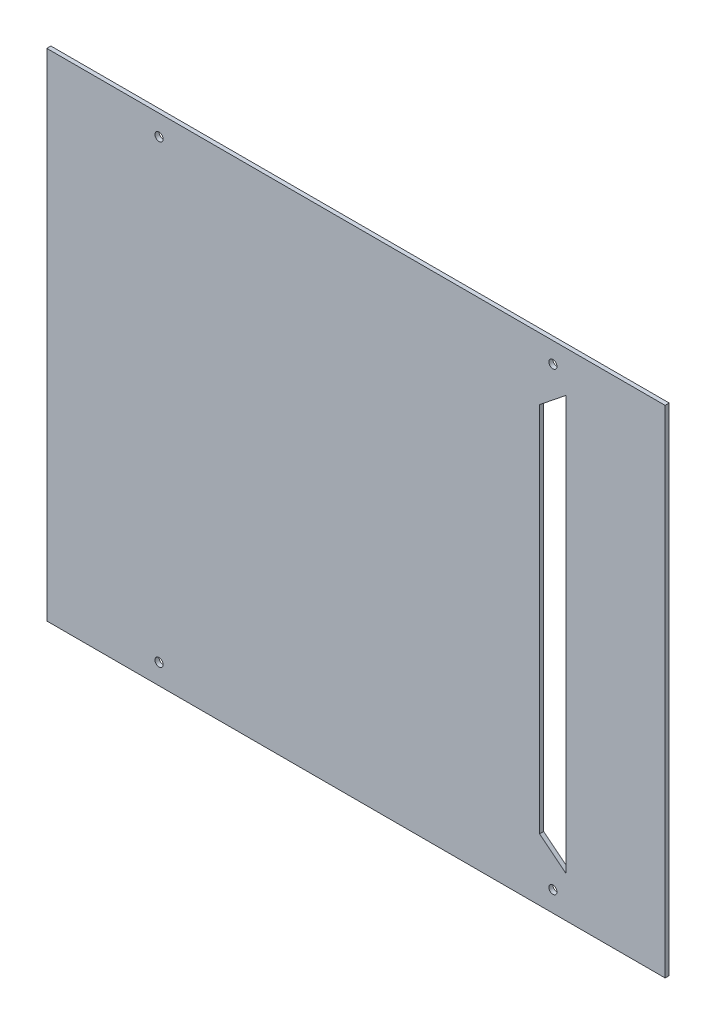
from build123d import *

# Parameters (mm, degrees)
SKETCH1_W           = 303
SKETCH1_H           = 243
SKETCH1_R           = 2
BOSS_EXTRUDE1_DEPTH = 2


with BuildPart() as part:
    # Sketch1 → Boss-Extrude1 (new body)
    with BuildSketch(Plane.XY):
        Rectangle(SKETCH1_W, SKETCH1_H)
        with Locations((-96.5, 111.5)):
            Circle(SKETCH1_R, mode=Mode.SUBTRACT)
        with Locations((96.5, 111.5)):
            Circle(SKETCH1_R, mode=Mode.SUBTRACT)
        with Locations((96.5, -111.5)):
            Circle(SKETCH1_R, mode=Mode.SUBTRACT)
        with Locations((-96.5, -111.5)):
            Circle(SKETCH1_R, mode=Mode.SUBTRACT)
        Polygon((103, 101.5), (103, -101.5), (90, -91.074257426), (90, 91.074257426), align=None, mode=Mode.SUBTRACT)
    extrude(amount=BOSS_EXTRUDE1_DEPTH)


solid = part.part
